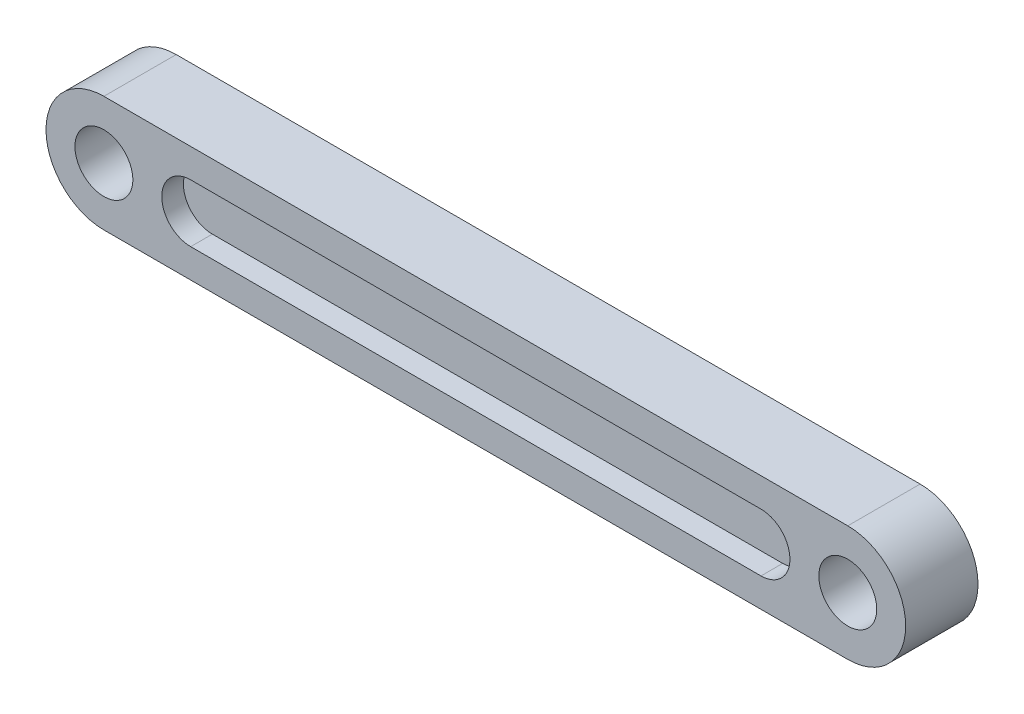
from build123d import *

# Parameters (mm, degrees)
BOSS_EXTRUDE1_DEPTH      = 5
CUT_EXTRUDE1_DEPTH       = 1.5
CUT_EXTRUDE2_DEPTH       = 1.5
F_4_0_4_DIAMETER_HOLE1_D = 4


with BuildPart() as part:
    # Sketch1 → Boss-Extrude1 (new body)
    with BuildSketch(Plane(origin=(0, 0, 0), x_dir=(-1, 0, 0), z_dir=(0, 0, -1))):
        with BuildLine():
            Line((0, 4), (-51.4197, 4))
            ThreePointArc((-51.4197, 4), (-55.4197, 0), (-51.4197, -4))
            Line((-51.4197, -4), (0, -4))
            ThreePointArc((0, -4), (4, 0), (0, 4))
        make_face()
    extrude(amount=-BOSS_EXTRUDE1_DEPTH)

    # Sketch2 → Cut-Extrude1 (cut)
    with BuildSketch(Plane(origin=(0, 0, 0), x_dir=(-1, 0, 0), z_dir=(0, 0, -1))):
        with BuildLine():
            Line((-6, 2.5), (-45.4197, 2.5))
            ThreePointArc((-45.4197, 2.5), (-47.9197, 0), (-45.4197, -2.5))
            Line((-45.4197, -2.5), (-6, -2.5))
            ThreePointArc((-6, -2.5), (-3.5, 0), (-6, 2.5))
        make_face()
    extrude(amount=-CUT_EXTRUDE1_DEPTH, mode=Mode.SUBTRACT)

    # Sketch3 → Cut-Extrude2 (cut)
    with BuildSketch(Plane.XY.offset(5)):
        with BuildLine():
            Line((6, -2), (45.4197, -2))
            ThreePointArc((45.4197, -2), (47.4197, 0), (45.4197, 2))
            Line((45.4197, 2), (6, 2))
            ThreePointArc((6, 2), (4, 0), (6, -2))
        make_face()
    extrude(amount=-CUT_EXTRUDE2_DEPTH, mode=Mode.SUBTRACT)

    # Ø4.0 (4) Diameter Hole1 (through all)
    with Locations(Plane(origin=(0, 0, 0), x_dir=(-1, 0, 0), z_dir=(0, 0, -1))):
        with Locations((-51.4197, 0), (0, 0)):
            Hole(F_4_0_4_DIAMETER_HOLE1_D / 2)


solid = part.part
